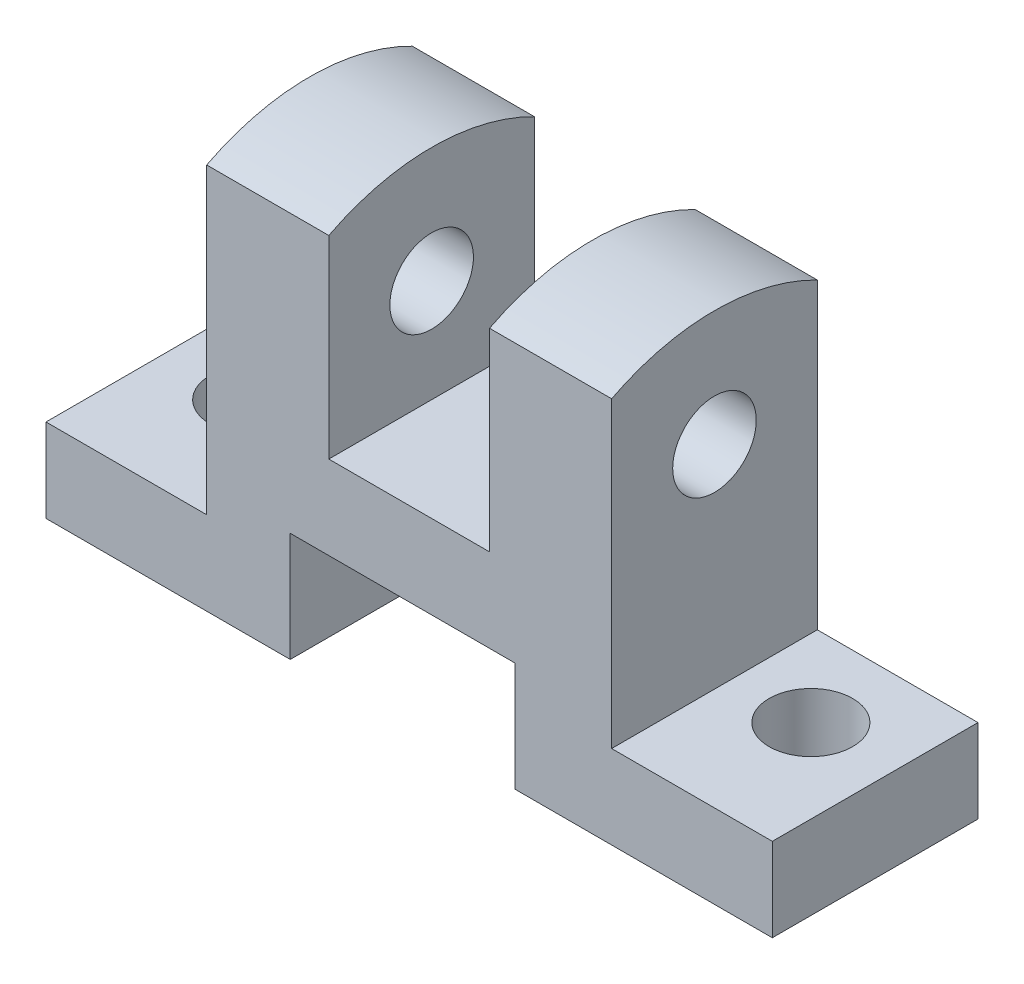
from build123d import *

# Parameters (mm, degrees)
BOSS_EXTRUDE1_DEPTH     = 32
SKETCH2_R               = 6.5
CUT_EXTRUDE1_DEPTH      = 32
SKETCH3_R               = 6.5
CUT_EXTRUDE2_DEPTH      = 76
CUT_EXTRUDE5_DEPTH      = 102.3894291
CUT_EXTRUDE5_DEPTH_BACK = 102.3894291


with BuildPart() as part:
    # Sketch1 → Boss-Extrude1 (new body)
    with BuildSketch(Plane.XY):
        Polygon((-64.877213136, -12.117917581), (-64.877213136, -25.117917581), (-26.877213136, -25.117917581), (-26.877213136, -8.117917581), (8.122786864, -8.117917581), (8.122786864, -25.117917581), (48.122786864, -25.117917581), (48.122786864, -12.117917581), (23.122786864, -12.117917581), (23.122786864, 38.882082419), (4.122786864, 38.882082419), (4.122786864, 4.882082419), (-20.877213136, 4.882082419), (-20.877213136, 38.882082419), (-39.877213136, 38.882082419), (-39.877213136, -12.117917581), align=None)
    extrude(amount=BOSS_EXTRUDE1_DEPTH)

    # Sketch2 → Cut-Extrude1 (cut)
    with BuildSketch(Plane(origin=(0, -12.117917581, 0), x_dir=(1, 0, 0), z_dir=(0, 1, 0))):
        with Locations((35.122786864, -13)):
            Circle(SKETCH2_R)
        with Locations((-51.877213136, -13)):
            Circle(SKETCH2_R)
    extrude(amount=-CUT_EXTRUDE1_DEPTH, mode=Mode.SUBTRACT)

    # Sketch3 → Cut-Extrude2 (cut)
    with BuildSketch(Plane.ZY.offset(39.877213136)):
        with Locations((16, 20.882082419)):
            Circle(SKETCH3_R)
    extrude(amount=-CUT_EXTRUDE2_DEPTH, mode=Mode.SUBTRACT)

    # Sketch4 → Cut-Extrude5 (cut, two sides: drawn at the far end of the back side and taken through both)
    with BuildSketch(Plane(origin=(23.122786864, 0, 0), x_dir=(0, 0, -1), z_dir=(1, 0, 0)).offset(-CUT_EXTRUDE5_DEPTH_BACK)):
        with BuildLine():
            Line((0, 38.882082419), (-16, 38.882082419))
            ThreePointArc((-16, 38.882082419), (-7.769166784, 37.900509551), (0, 35.010847251))
            Line((0, 35.010847251), (0, 38.882082419))
        make_face()
        with BuildLine():
            Line((-16, 38.882082419), (-32, 38.882082419))
            Line((-32, 38.882082419), (-32, 35.010847251))
            ThreePointArc((-32, 35.010847251), (-24.230833216, 37.900509551), (-16, 38.882082419))
        make_face()
    extrude(amount=CUT_EXTRUDE5_DEPTH + CUT_EXTRUDE5_DEPTH_BACK, mode=Mode.SUBTRACT)


solid = part.part
